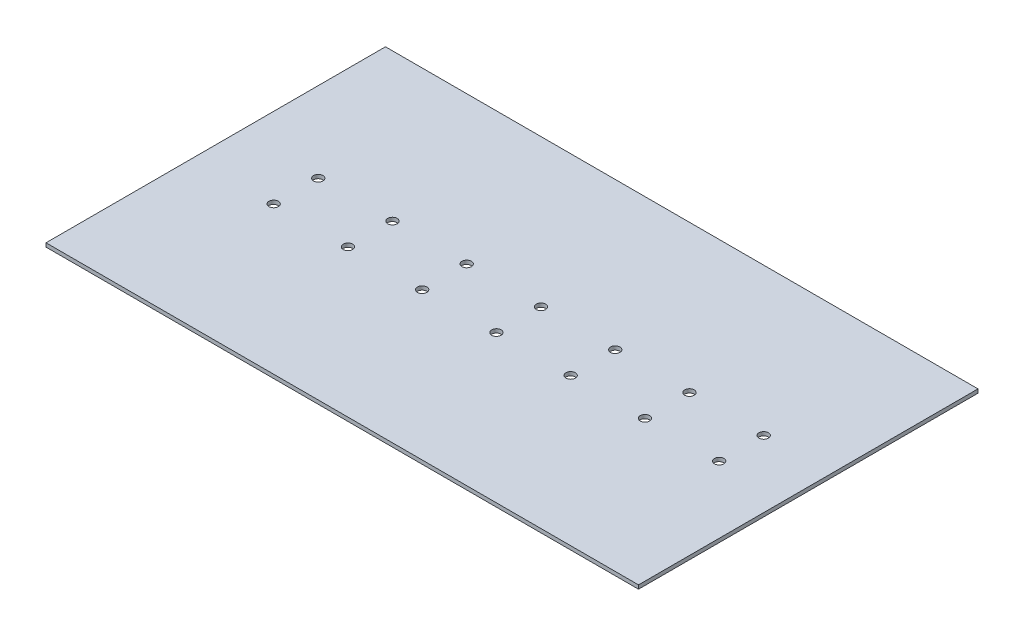
from build123d import *

# Parameters (mm, degrees)
SKETCH1_W                            = 399
SKETCH1_H                            = 228.6
BASE_DEPTH                           = 2.54
HOLE_FOR_10_BLIND_FASTENERS_B_BS_1_D = 6.35


with BuildPart() as part:
    # Sketch1 → Base (new body)
    with BuildSketch(Plane(origin=(0, 0, 0), x_dir=(1, 0, 0), z_dir=(0, 1, 0))):
        with Locations((199.5, -114.3)):
            Rectangle(SKETCH1_W, SKETCH1_H)
    extrude(amount=-BASE_DEPTH)

    # Hole for #10 Blind Fasteners (B,BS)1 (through all)
    with Locations(Plane(origin=(0, 0, 0), x_dir=(1, 0, 0), z_dir=(0, 1, 0))):
        with Locations((354, -129.3), (304, -129.3), (254, -129.3), (204, -129.3), (154, -129.3), (104, -129.3), (54, -129.3), (54, -99.3), (104, -99.3), (154, -99.3), (204, -99.3), (254, -99.3), (304, -99.3), (354, -99.3)):
            Hole(HOLE_FOR_10_BLIND_FASTENERS_B_BS_1_D / 2)


solid = part.part
